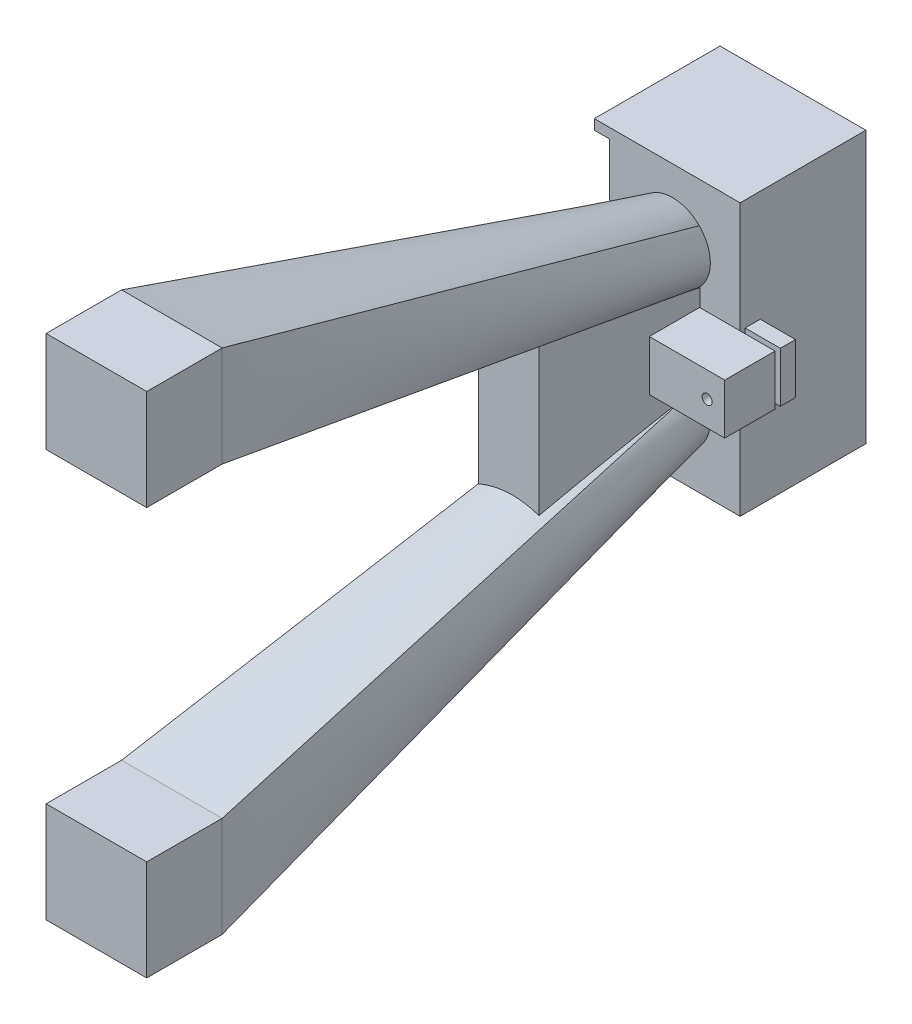
from build123d import *

# Parameters (mm, degrees)
EXTRUDE_6_DEPTH           = 3
EXTRUDE_6_DEPTH_BACK      = 26
SKETCH_13_W               = 25
SKETCH_13_H               = 54
SKETCH_16_W               = 22
SKETCH_16_H               = 50
CUT_EXTRUDE_9_DEPTH       = 3
SKETCH_17_W               = 5
SKETCH_17_H               = 15
CUT_EXTRUDE_10_DEPTH      = 8
EXTRUDE_14_OUTLINE_W      = 20
EXTRUDE_14_OUTLINE_H      = 20
EXTRUDE_14_DEPTH          = 15
EXTRUDE_14_3_OUTLINE_W    = 20
EXTRUDE_14_3_OUTLINE_H    = 20
EXTRUDE_14_3_DEPTH        = 15
EXTRUDE_15_DEPTH          = 5
EXTRUDE_15_DEPTH_BACK     = 7
SKETCH_25_W               = 10
SKETCH_25_H               = 10
EXTRUDE_17_DEPTH          = 20
SKETCH_26_W               = 3
SKETCH_26_H               = 10
EXTRUDE_18_DEPTH          = 10
CUT_EXTRUDE_11_DEPTH      = 10.5
CUT_EXTRUDE_11_DEPTH_BACK = 10.5
SKETCH_28_R               = 1


with BuildPart() as part:
    # 草圖13 → 填料-伸長6 (new, two sides: drawn at the far end of the back side and taken through both)
    with BuildSketch(Plane(origin=(95, 0, 0), x_dir=(0, 0, -1), z_dir=(1, 0, 0)).offset(-EXTRUDE_6_DEPTH_BACK)):
        with Locations((112.5, -3)):
            Rectangle(SKETCH_13_W, SKETCH_13_H)
    extrude(amount=EXTRUDE_6_DEPTH + EXTRUDE_6_DEPTH_BACK)

    # 草圖16 → 除料-伸長9 (cut)
    with BuildSketch(Plane(origin=(69, 0, 0), x_dir=(0, 0, -1), z_dir=(1, 0, 0))):
        with Locations((111, -3)):
            Rectangle(SKETCH_16_W, SKETCH_16_H)
    extrude(amount=CUT_EXTRUDE_9_DEPTH, mode=Mode.SUBTRACT)

    # 草圖17 → 除料-伸長10 (cut)
    with BuildSketch(Plane(origin=(69, 0, 0), x_dir=(0, 0, -1), z_dir=(1, 0, 0))):
        with Locations((102.5, -3)):
            Rectangle(SKETCH_17_W, SKETCH_17_H)
    extrude(amount=CUT_EXTRUDE_10_DEPTH, mode=Mode.SUBTRACT)



with BuildPart() as body_2:
    # Knit 1: read off the stored shape, not the designer's step
    # Knit 1: loft between two sections, ruled curve by curve
    knit_1_from = [
        Edge.make_bspline([(79.266895317, 5.377196179, -100), (79.579395317, 5.064696179, -100), (79.931362244, 4.768290315, -100), (80.709511323, 4.233165726, -100), (81.135733214, 3.994620259, -100), (82.046998926, 3.600245646, -100), (82.531971403, 3.444609801, -100), (83.534778832, 3.234670337, -100), (84.052429223, 3.180497037, -100), (85.087963129, 3.180497037, -100), (85.60561352, 3.234670337, -100), (86.608420949, 3.444609801, -100), (87.093393426, 3.600245646, -100), (88.004659138, 3.994620259, -100), (88.430881029, 4.233165726, -100), (89.209030109, 4.768290315, -100), (89.560997035, 5.064696179, -100), (89.873497035, 5.377196179, -100)], [0, 0, 0, 0, 0.125, 0.125, 0.25, 0.25, 0.375, 0.375, 0.5, 0.5, 0.625, 0.625, 0.75, 0.75, 0.875, 0.875, 1, 1, 1, 1], 3),
        Edge.make_bspline([(89.873497035, 5.377196179, -100), (90.185997035, 5.689696179, -100), (90.482402899, 6.041663105, -100), (91.017527488, 6.819812184, -100), (91.256072955, 7.246034075, -100), (91.650447568, 8.157299787, -100), (91.806083413, 8.642272265, -100), (92.016022877, 9.645079694, -100), (92.070196176, 10.162730084, -100), (92.070196176, 11.19826399, -100), (92.016022877, 11.715914381, -100), (91.806083413, 12.71872181, -100), (91.650447568, 13.203694288, -100), (91.256072955, 14.11496, -100), (91.017527488, 14.541181891, -100), (90.482402899, 15.31933097, -100), (90.185997035, 15.671297896, -100), (89.873497035, 15.983797896, -100)], [0, 0, 0, 0, 0.125, 0.125, 0.25, 0.25, 0.375, 0.375, 0.5, 0.5, 0.625, 0.625, 0.75, 0.75, 0.875, 0.875, 1, 1, 1, 1], 3),
        Edge.make_bspline([(79.266895317, 15.983797896, -100), (78.954395317, 15.671297896, -100), (78.657989454, 15.31933097, -100), (78.122864864, 14.541181891, -100), (77.884319398, 14.11496, -100), (77.489944785, 13.203694288, -100), (77.334308939, 12.71872181, -100), (77.124369476, 11.715914381, -100), (77.070196176, 11.19826399, -100), (77.070196176, 10.162730084, -100), (77.124369476, 9.645079694, -100), (77.334308939, 8.642272265, -100), (77.489944785, 8.157299787, -100), (77.884319398, 7.246034075, -100), (78.122864864, 6.819812184, -100), (78.657989454, 6.041663105, -100), (78.954395317, 5.689696179, -100), (79.266895317, 5.377196179, -100)], [0, 0, 0, 0, 0.125, 0.125, 0.25, 0.25, 0.375, 0.375, 0.5, 0.5, 0.625, 0.625, 0.75, 0.75, 0.875, 0.875, 1, 1, 1, 1], 3),
        Edge.make_bspline([(89.873497035, 15.983797896, -100), (89.560997035, 16.296297896, -100), (89.209030109, 16.59270376, -100), (88.430881029, 17.127828349, -100), (88.004659138, 17.366373816, -100), (87.093393426, 17.760748429, -100), (86.608420949, 17.916384274, -100), (85.60561352, 18.126323738, -100), (85.087963129, 18.180497037, -100), (84.052429223, 18.180497037, -100), (83.534778832, 18.126323738, -100), (82.531971403, 17.916384274, -100), (82.046998926, 17.760748429, -100), (81.135733214, 17.366373816, -100), (80.709511323, 17.127828349, -100), (79.931362244, 16.59270376, -100), (79.579395317, 16.296297896, -100), (79.266895317, 15.983797896, -100)], [0, 0, 0, 0, 0.125, 0.125, 0.25, 0.25, 0.375, 0.375, 0.5, 0.5, 0.625, 0.625, 0.75, 0.75, 0.875, 0.875, 1, 1, 1, 1], 3),
    ]
    knit_1_to = [
        Edge.make_bspline([(75, 27.5, 0), (75.833333333, 27.5, 0), (76.666666667, 27.5, 0), (78.333333333, 27.5, 0), (79.166666667, 27.5, 0), (80.833333333, 27.5, 0), (81.666666667, 27.5, 0), (83.333333333, 27.5, 0), (84.166666667, 27.5, 0), (85.833333333, 27.5, 0), (86.666666667, 27.5, 0), (88.333333333, 27.5, 0), (89.166666667, 27.5, 0), (90.833333333, 27.5, 0), (91.666666667, 27.5, 0), (93.333333333, 27.5, 0), (94.166666667, 27.5, 0), (95, 27.5, 0)], [0, 0, 0, 0, 0.125, 0.125, 0.25, 0.25, 0.375, 0.375, 0.5, 0.5, 0.625, 0.625, 0.75, 0.75, 0.875, 0.875, 1, 1, 1, 1], 3),
        Edge.make_bspline([(95, 27.5, 0), (95, 28.333333333, 0), (95, 29.166666667, 0), (95, 30.833333333, 0), (95, 31.666666667, 0), (95, 33.333333333, 0), (95, 34.166666667, 0), (95, 35.833333333, 0), (95, 36.666666667, 0), (95, 38.333333333, 0), (95, 39.166666667, 0), (95, 40.833333333, 0), (95, 41.666666667, 0), (95, 43.333333333, 0), (95, 44.166666667, 0), (95, 45.833333333, 0), (95, 46.666666667, 0), (95, 47.5, 0)], [0, 0, 0, 0, 0.125, 0.125, 0.25, 0.25, 0.375, 0.375, 0.5, 0.5, 0.625, 0.625, 0.75, 0.75, 0.875, 0.875, 1, 1, 1, 1], 3),
        Edge.make_bspline([(75, 47.5, 0), (75, 46.666666667, 0), (75, 45.833333333, 0), (75, 44.166666667, 0), (75, 43.333333333, 0), (75, 41.666666667, 0), (75, 40.833333333, 0), (75, 39.166666667, 0), (75, 38.333333333, 0), (75, 36.666666667, 0), (75, 35.833333333, 0), (75, 34.166666667, 0), (75, 33.333333333, 0), (75, 31.666666667, 0), (75, 30.833333333, 0), (75, 29.166666667, 0), (75, 28.333333333, 0), (75, 27.5, 0)], [0, 0, 0, 0, 0.125, 0.125, 0.25, 0.25, 0.375, 0.375, 0.5, 0.5, 0.625, 0.625, 0.75, 0.75, 0.875, 0.875, 1, 1, 1, 1], 3),
        Edge.make_bspline([(95, 47.5, 0), (94.166666667, 47.5, 0), (93.333333333, 47.5, 0), (91.666666667, 47.5, 0), (90.833333333, 47.5, 0), (89.166666667, 47.5, 0), (88.333333333, 47.5, 0), (86.666666667, 47.5, 0), (85.833333333, 47.5, 0), (84.166666667, 47.5, 0), (83.333333333, 47.5, 0), (81.666666667, 47.5, 0), (80.833333333, 47.5, 0), (79.166666667, 47.5, 0), (78.333333333, 47.5, 0), (76.666666667, 47.5, 0), (75.833333333, 47.5, 0), (75, 47.5, 0)], [0, 0, 0, 0, 0.125, 0.125, 0.25, 0.25, 0.375, 0.375, 0.5, 0.5, 0.625, 0.625, 0.75, 0.75, 0.875, 0.875, 1, 1, 1, 1], 3),
    ]
    knit_1 = Solid(Shell([*[Face.make_surface_from_curves(knit_1_from[k], knit_1_to[k]) for k in range(4)], Face(Wire(knit_1_from)), Face(Wire(knit_1_to))]))
    add(knit_1)

    # Extrude 14 3 outline → Extrude 14 3 (add)
    with BuildSketch(Plane.XY):
        with Locations((85, 37.5)):
            Rectangle(EXTRUDE_14_3_OUTLINE_W, EXTRUDE_14_3_OUTLINE_H)
    extrude(amount=EXTRUDE_14_3_DEPTH)


with BuildPart() as body_3:
    # 填料-伸長14: read off the stored shape, not the designer's step
    # 填料-伸長14 outline → 填料-伸長14 (new body)
    with BuildSketch(Plane.XY):
        with Locations((85, -43.5)):
            Rectangle(EXTRUDE_14_OUTLINE_W, EXTRUDE_14_OUTLINE_H)
    extrude(amount=EXTRUDE_14_DEPTH)

    # Extrude 14 2: loft between two sections, ruled curve by curve
    extrude_14_2_from = [
        Edge.make_bspline([(79.266895317, -21.983797896, -100), (79.579395317, -22.296297896, -100), (79.931362244, -22.59270376, -100), (80.709511323, -23.127828349, -100), (81.135733214, -23.366373816, -100), (82.046998926, -23.760748429, -100), (82.531971403, -23.916384274, -100), (83.534778832, -24.126323738, -100), (84.052429223, -24.180497037, -100), (85.087963129, -24.180497037, -100), (85.60561352, -24.126323738, -100), (86.608420949, -23.916384274, -100), (87.093393426, -23.760748429, -100), (88.004659138, -23.366373816, -100), (88.430881029, -23.127828349, -100), (89.209030109, -22.59270376, -100), (89.560997035, -22.296297896, -100), (89.873497035, -21.983797896, -100)], [0, 0, 0, 0, 0.125, 0.125, 0.25, 0.25, 0.375, 0.375, 0.5, 0.5, 0.625, 0.625, 0.75, 0.75, 0.875, 0.875, 1, 1, 1, 1], 3),
        Edge.make_bspline([(89.873497035, -21.983797896, -100), (90.185997035, -21.671297896, -100), (90.482402899, -21.31933097, -100), (91.017527488, -20.541181891, -100), (91.256072955, -20.11496, -100), (91.650447568, -19.203694288, -100), (91.806083413, -18.71872181, -100), (92.016022877, -17.715914381, -100), (92.070196176, -17.19826399, -100), (92.070196176, -16.162730084, -100), (92.016022877, -15.645079694, -100), (91.806083413, -14.642272265, -100), (91.650447568, -14.157299787, -100), (91.256072955, -13.246034075, -100), (91.017527488, -12.819812184, -100), (90.482402899, -12.041663105, -100), (90.185997035, -11.689696179, -100), (89.873497035, -11.377196179, -100)], [0, 0, 0, 0, 0.125, 0.125, 0.25, 0.25, 0.375, 0.375, 0.5, 0.5, 0.625, 0.625, 0.75, 0.75, 0.875, 0.875, 1, 1, 1, 1], 3),
        Edge.make_bspline([(79.266895317, -11.377196179, -100), (78.954395317, -11.689696179, -100), (78.657989454, -12.041663105, -100), (78.122864864, -12.819812184, -100), (77.884319398, -13.246034075, -100), (77.489944785, -14.157299787, -100), (77.334308939, -14.642272265, -100), (77.124369476, -15.645079694, -100), (77.070196176, -16.162730084, -100), (77.070196176, -17.19826399, -100), (77.124369476, -17.715914381, -100), (77.334308939, -18.71872181, -100), (77.489944785, -19.203694288, -100), (77.884319398, -20.11496, -100), (78.122864864, -20.541181891, -100), (78.657989454, -21.31933097, -100), (78.954395317, -21.671297896, -100), (79.266895317, -21.983797896, -100)], [0, 0, 0, 0, 0.125, 0.125, 0.25, 0.25, 0.375, 0.375, 0.5, 0.5, 0.625, 0.625, 0.75, 0.75, 0.875, 0.875, 1, 1, 1, 1], 3),
        Edge.make_bspline([(89.873497035, -11.377196179, -100), (89.560997035, -11.064696179, -100), (89.209030109, -10.768290315, -100), (88.430881029, -10.233165726, -100), (88.004659138, -9.994620259, -100), (87.093393426, -9.600245646, -100), (86.608420949, -9.444609801, -100), (85.60561352, -9.234670337, -100), (85.087963129, -9.180497037, -100), (84.052429223, -9.180497037, -100), (83.534778832, -9.234670337, -100), (82.531971403, -9.444609801, -100), (82.046998926, -9.600245646, -100), (81.135733214, -9.994620259, -100), (80.709511323, -10.233165726, -100), (79.931362244, -10.768290315, -100), (79.579395317, -11.064696179, -100), (79.266895317, -11.377196179, -100)], [0, 0, 0, 0, 0.125, 0.125, 0.25, 0.25, 0.375, 0.375, 0.5, 0.5, 0.625, 0.625, 0.75, 0.75, 0.875, 0.875, 1, 1, 1, 1], 3),
    ]
    extrude_14_2_to = [
        Edge.make_bspline([(75, -53.5, 0), (75.833333333, -53.5, 0), (76.666666667, -53.5, 0), (78.333333333, -53.5, 0), (79.166666667, -53.5, 0), (80.833333333, -53.5, 0), (81.666666667, -53.5, 0), (83.333333333, -53.5, 0), (84.166666667, -53.5, 0), (85.833333333, -53.5, 0), (86.666666667, -53.5, 0), (88.333333333, -53.5, 0), (89.166666667, -53.5, 0), (90.833333333, -53.5, 0), (91.666666667, -53.5, 0), (93.333333333, -53.5, 0), (94.166666667, -53.5, 0), (95, -53.5, 0)], [0, 0, 0, 0, 0.125, 0.125, 0.25, 0.25, 0.375, 0.375, 0.5, 0.5, 0.625, 0.625, 0.75, 0.75, 0.875, 0.875, 1, 1, 1, 1], 3),
        Edge.make_bspline([(95, -53.5, 0), (95, -52.666666667, 0), (95, -51.833333333, 0), (95, -50.166666667, 0), (95, -49.333333333, 0), (95, -47.666666667, 0), (95, -46.833333333, 0), (95, -45.166666667, 0), (95, -44.333333333, 0), (95, -42.666666667, 0), (95, -41.833333333, 0), (95, -40.166666667, 0), (95, -39.333333333, 0), (95, -37.666666667, 0), (95, -36.833333333, 0), (95, -35.166666667, 0), (95, -34.333333333, 0), (95, -33.5, 0)], [0, 0, 0, 0, 0.125, 0.125, 0.25, 0.25, 0.375, 0.375, 0.5, 0.5, 0.625, 0.625, 0.75, 0.75, 0.875, 0.875, 1, 1, 1, 1], 3),
        Edge.make_bspline([(75, -33.5, 0), (75, -34.333333333, 0), (75, -35.166666667, 0), (75, -36.833333333, 0), (75, -37.666666667, 0), (75, -39.333333333, 0), (75, -40.166666667, 0), (75, -41.833333333, 0), (75, -42.666666667, 0), (75, -44.333333333, 0), (75, -45.166666667, 0), (75, -46.833333333, 0), (75, -47.666666667, 0), (75, -49.333333333, 0), (75, -50.166666667, 0), (75, -51.833333333, 0), (75, -52.666666667, 0), (75, -53.5, 0)], [0, 0, 0, 0, 0.125, 0.125, 0.25, 0.25, 0.375, 0.375, 0.5, 0.5, 0.625, 0.625, 0.75, 0.75, 0.875, 0.875, 1, 1, 1, 1], 3),
        Edge.make_bspline([(95, -33.5, 0), (94.166666667, -33.5, 0), (93.333333333, -33.5, 0), (91.666666667, -33.5, 0), (90.833333333, -33.5, 0), (89.166666667, -33.5, 0), (88.333333333, -33.5, 0), (86.666666667, -33.5, 0), (85.833333333, -33.5, 0), (84.166666667, -33.5, 0), (83.333333333, -33.5, 0), (81.666666667, -33.5, 0), (80.833333333, -33.5, 0), (79.166666667, -33.5, 0), (78.333333333, -33.5, 0), (76.666666667, -33.5, 0), (75.833333333, -33.5, 0), (75, -33.5, 0)], [0, 0, 0, 0, 0.125, 0.125, 0.25, 0.25, 0.375, 0.375, 0.5, 0.5, 0.625, 0.625, 0.75, 0.75, 0.875, 0.875, 1, 1, 1, 1], 3),
    ]
    extrude_14_2 = Solid(Shell([*[Face.make_surface_from_curves(extrude_14_2_from[k], extrude_14_2_to[k]) for k in range(4)], Face(Wire(extrude_14_2_from)), Face(Wire(extrude_14_2_to))]))
    add(extrude_14_2)


with BuildPart() as part_1:
    add(part.part)

    add(body_2.part)  # 填料-伸長15 merges body 2

    add(body_3.part)  # 填料-伸長15 merges body 3
    # 草圖23 → 填料-伸長15 (add, two sides: drawn at the far end of the back side and taken through both)
    with BuildSketch(Plane(origin=(85, 0, 0), x_dir=(0, 0, -1), z_dir=(1, 0, 0)).offset(-EXTRUDE_15_DEPTH_BACK)):
        Polygon((75.431487816, -16.812439931), (100, -11.377196179), (100, 3.180497037), (100, 5.377196179), (68, 12.456493401), (68, -18.456493401), align=None)
    extrude(amount=EXTRUDE_15_DEPTH + EXTRUDE_15_DEPTH_BACK)

    # 草圖25 → 填料-伸長17 (add)
    with BuildSketch(Plane(origin=(85, 0, 0), x_dir=(0, 0, -1), z_dir=(1, 0, 0))):
        with Locations((94.938395857, -3)):
            Rectangle(SKETCH_25_W, SKETCH_25_H)
    extrude(amount=EXTRUDE_17_DEPTH)

    # 草圖26 → 填料-伸長18 (add)
    with BuildSketch(Plane(origin=(95, 0, 0), x_dir=(0, 0, -1), z_dir=(1, 0, 0))):
        with Locations((102.5, -3.051173544)):
            Rectangle(SKETCH_26_W, SKETCH_26_H)
    extrude(amount=EXTRUDE_18_DEPTH)

    # 草圖28 → 除料-伸長11 (cut, two sides: drawn at the far end of the back side and taken through both)
    with BuildSketch(Plane.XY.offset(-100).offset(-CUT_EXTRUDE_11_DEPTH_BACK)):
        with Locations(Location((101.5, -3.051173544, 0), (0, 0, 180))):
            Circle(SKETCH_28_R)
    extrude(amount=CUT_EXTRUDE_11_DEPTH + CUT_EXTRUDE_11_DEPTH_BACK, mode=Mode.SUBTRACT)


solid = part_1.part
